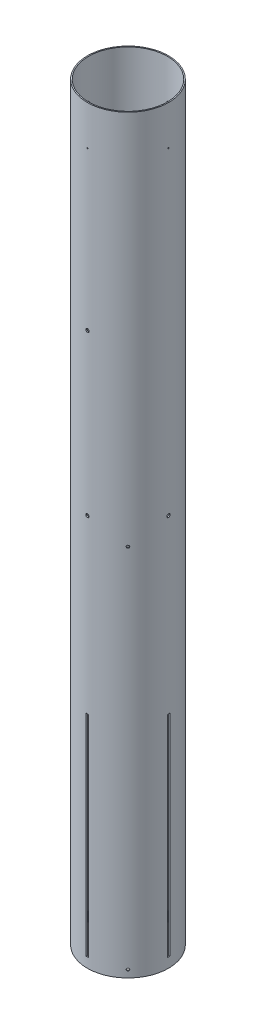
from build123d import *

# Parameters (mm, degrees)
SUSTAINER_TUBE_PROFILE_R       = 78.359
SUSTAINER_TUBE_PROFILE_R_2     = 76.2
SUSTAINER_TUBE_BODY_DEPTH      = 1447.8
FIN_SLOT_CUT_REACH             = 1460.364
FIN_SLOT_CUT_END_RADIUS        = 76.2
FIN_SLOT_PROFILE_W             = 4.7625
FIN_SLOT_PROFILE_H             = 406.4
FIN_SLOT_PATTERN_COUNT         = 4
SKETCH1_R                      = 1.143
CUT_EXTRUDE1_DEPTH             = 1453.034815616
CIRPATTERN1_COUNT              = 4
CUT_EXTRUDE2_DEPTH             = 1453.034815727
CUT_EXTRUDE2_DEPTH_BACK        = 1453.034815727
SKETCH2_R                      = 3.175
SKETCH3_R                      = 3.175
CUT_EXTRUDE3_DEPTH             = 1453.034815727
CIRPATTERN2_COUNT              = 4
CUT_EXTRUDE4_REACH             = 1462.107
CUT_EXTRUDE4_END_RADIUS        = 76.2
SKETCH4_R                      = 2.5019
CUT_EXTRUDE4_DIRECTION_2_DEPTH = 1461.106899298


with BuildPart() as part:
    # Sustainer Tube Profile → Sustainer Tube Body (new body)
    with BuildSketch(Plane(origin=(0, 0, 0), x_dir=(1, 0, 0), z_dir=(0, 1, 0))):
        Circle(SUSTAINER_TUBE_PROFILE_R)
        Circle(SUSTAINER_TUBE_PROFILE_R_2, mode=Mode.SUBTRACT)
    extrude(amount=SUSTAINER_TUBE_BODY_DEPTH)

    # Fin Slot Cut: up to this cylinder (the profile starts outside it)
    fin_slot_cut_end = Plane(origin=(0, 222.25, 0), z_dir=(0, -1, 0)) * Cylinder(FIN_SLOT_CUT_END_RADIUS, 3074.128, mode=Mode.PRIVATE)
    # Fin Slot Profile → Fin Slot Cut (cut, up to the surface)
    with BuildSketch(Plane.XY.offset(78.359), mode=Mode.PRIVATE) as fin_slot_cut_sk1:
        with Locations((0, 222.25)):
            Rectangle(FIN_SLOT_PROFILE_W, FIN_SLOT_PROFILE_H)
    fin_slot_cut_tool1 = extrude(fin_slot_cut_sk1.sketch, amount=-FIN_SLOT_CUT_REACH, mode=Mode.PRIVATE) - fin_slot_cut_end
    fin_slot_cut = fin_slot_cut_tool1.solids().sort_by_distance((0, 222.25, 78.359))[0]
    add(fin_slot_cut, mode=Mode.SUBTRACT)

    # Fin Slot Pattern: Fin Slot Cut ×4 about axis
    fin_slot_pattern_axis = Axis((0, 1447.8, 0), (0, 1, 0))
    for i in range(1, FIN_SLOT_PATTERN_COUNT):
        add(fin_slot_cut.rotate(fin_slot_pattern_axis, i * 360 / FIN_SLOT_PATTERN_COUNT), mode=Mode.SUBTRACT)

    # Sketch1 → Cut-Extrude1 (cut, symmetric)
    with BuildSketch(Plane.XY):
        with Locations((0, 1371.6)):
            Circle(SKETCH1_R)
    cut_extrude1 = extrude(amount=CUT_EXTRUDE1_DEPTH, both=True, mode=Mode.SUBTRACT)

    # CirPattern1: Cut-Extrude1 ×4 about axis
    cirpattern1_axis = Axis((0, 1447.8, 0), (0, 1, 0))
    for i in range(1, CIRPATTERN1_COUNT):
        add(cut_extrude1.rotate(cirpattern1_axis, i * 360 / CIRPATTERN1_COUNT), mode=Mode.SUBTRACT)

    # Sketch2 → Cut-Extrude2 (cut, two sides: drawn at the far end of the back side and taken through both)
    with BuildSketch(Plane.XY.offset(-CUT_EXTRUDE2_DEPTH_BACK)):
        with Locations((0, 1066.8)):
            Circle(SKETCH2_R)
    extrude(amount=CUT_EXTRUDE2_DEPTH + CUT_EXTRUDE2_DEPTH_BACK, mode=Mode.SUBTRACT)

    # Sketch3 → Cut-Extrude3 (cut, symmetric)
    with BuildSketch(Plane.XY):
        with Locations((0, 756.9962)):
            Circle(SKETCH3_R)
    cut_extrude3 = extrude(amount=CUT_EXTRUDE3_DEPTH, both=True, mode=Mode.SUBTRACT)

    # CirPattern2: Cut-Extrude3 ×4 about axis
    cirpattern2_axis = Axis((0, 1447.8, 0), (0, 1, 0))
    for i in range(1, CIRPATTERN2_COUNT):
        add(cut_extrude3.rotate(cirpattern2_axis, i * 360 / CIRPATTERN2_COUNT), mode=Mode.SUBTRACT)

    # Cut-Extrude4: up to this cylinder (the profile starts outside it)
    cut_extrude4_end = Plane(origin=(0, 367.6523, 0), z_dir=(0, -1, 0)) * Cylinder(CUT_EXTRUDE4_END_RADIUS, 3784.8262, mode=Mode.PRIVATE)
    # Sketch4 → Cut-Extrude4 (cut, up to the surface)
    with BuildSketch(Plane(origin=(55.408180267, 0, 55.408180267), x_dir=(0, -1, 0), z_dir=(0.7071067811865488, 0, 0.7071067811865464)), mode=Mode.PRIVATE) as cut_extrude4_sk1:
        with Locations((-14.0462, 0)):
            Circle(SKETCH4_R)
    cut_extrude4_tool1 = extrude(cut_extrude4_sk1.sketch, amount=-CUT_EXTRUDE4_REACH, mode=Mode.PRIVATE) - cut_extrude4_end
    add(cut_extrude4_tool1.solids().sort_by_distance((55.40818, 14.0462, 55.40818))[0], mode=Mode.SUBTRACT)
    # Sketch4 → Cut-Extrude4 (cut, up to the surface)
    with BuildSketch(Plane(origin=(55.408180267, 0, 55.408180267), x_dir=(0, -1, 0), z_dir=(0.7071067811865488, 0, 0.7071067811865464)), mode=Mode.PRIVATE) as cut_extrude4_sk2:
        with Locations((-721.2584, 0)):
            Circle(SKETCH4_R)
    cut_extrude4_tool2 = extrude(cut_extrude4_sk2.sketch, amount=-CUT_EXTRUDE4_REACH, mode=Mode.PRIVATE) - cut_extrude4_end
    add(cut_extrude4_tool2.solids().sort_by_distance((55.40818, 721.2584, 55.40818))[0], mode=Mode.SUBTRACT)

    # Sketch4 → Cut-Extrude4 direction 2 (cut)
    with BuildSketch(Plane(origin=(55.408180267, 0, 55.408180267), x_dir=(0, -1, 0), z_dir=(0.7071067811865488, 0, 0.7071067811865464))):
        with Locations((-14.0462, 0)):
            Circle(SKETCH4_R)
        with Locations((-721.2584, 0)):
            Circle(SKETCH4_R)
    extrude(amount=CUT_EXTRUDE4_DIRECTION_2_DEPTH, mode=Mode.SUBTRACT)


solid = part.part
